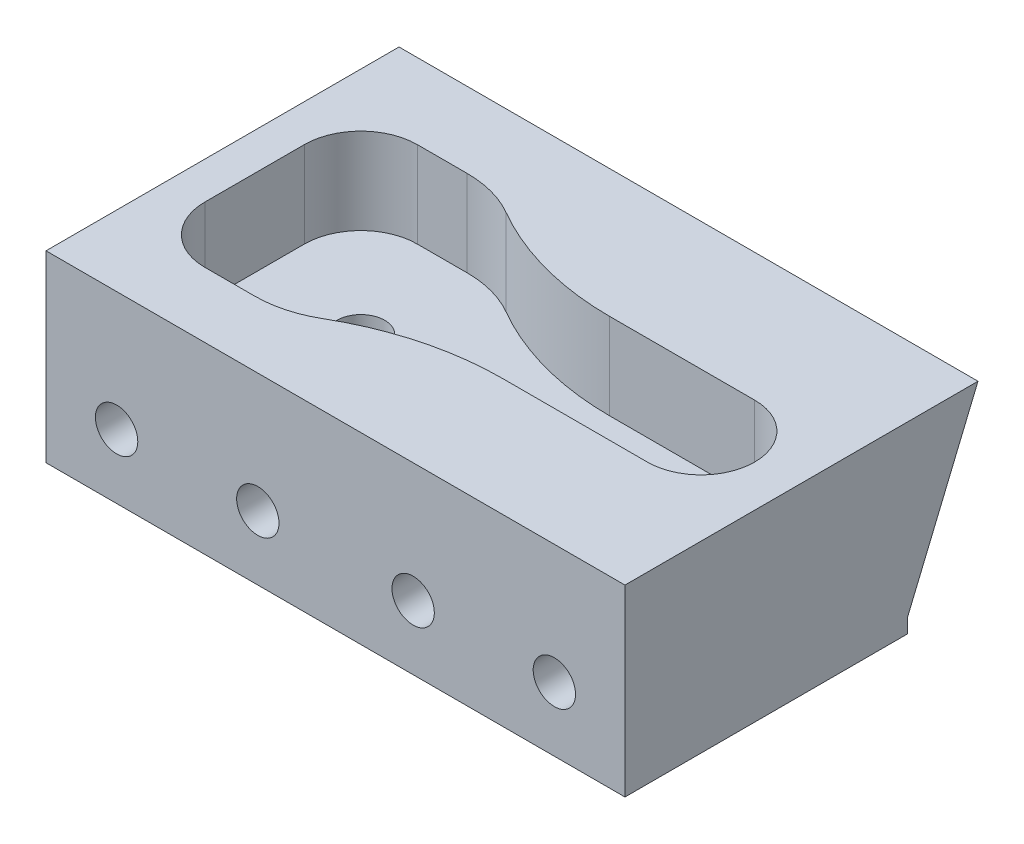
from build123d import *

# Parameters (mm, degrees)
SKETCH1_W                                           = 41
SKETCH1_H                                           = 25
BOSS_EXTRUDE1_DEPTH                                 = 13
SKETCH2_R                                           = 1.5
CUT_EXTRUDE1_DEPTH                                  = 50.749371855
LPATTERN1_COUNT                                     = 2
LPATTERN1_PITCH                                     = 10
LPATTERN3_COUNT                                     = 2
LPATTERN3_PITCH                                     = 21
SKETCH8_R                                           = 1.5
CUT_EXTRUDE5_DEPTH                                  = 8
CUT_EXTRUDE2_DEPTH                                  = 6.1
CBORE_FOR_M3_HEX_SOCKET_HEAD_CAP_SCREW1_D           = 3.4
CBORE_FOR_M3_HEX_SOCKET_HEAD_CAP_SCREW1_CBORE_D     = 6
CBORE_FOR_M3_HEX_SOCKET_HEAD_CAP_SCREW1_CBORE_DEPTH = 3.4
FILLET1_R                                           = 20
CUT_EXTRUDE4_DEPTH                                  = 50.749371855
CUT_EXTRUDE4_DEPTH_BACK                             = 50.749371855
BOSS_EXTRUDE3_START                                 = 0.2
BOSS_EXTRUDE3_DEPTH                                 = 0.2
LPATTERN2_COUNT                                     = 2
LPATTERN2_PITCH                                     = 24.09


with BuildPart() as part:
    # Sketch1 → Boss-Extrude1 (new body)
    with BuildSketch(Plane(origin=(0, 0, 0), x_dir=(1, 0, 0), z_dir=(0, 1, 0))):
        with Locations((20.5, 12.5)):
            Rectangle(SKETCH1_W, SKETCH1_H)
    extrude(amount=BOSS_EXTRUDE1_DEPTH)

    # Sketch2 → Cut-Extrude1 (cut, through all)
    with BuildSketch(Plane.XY):
        with Locations((5, 4.545)):
            Circle(SKETCH2_R)
    cut_extrude1 = extrude(amount=-CUT_EXTRUDE1_DEPTH, mode=Mode.SUBTRACT)

    # LPattern1: Cut-Extrude1 ×2
    with Locations(*[(i * LPATTERN1_PITCH, 0, 0) for i in range(1, LPATTERN1_COUNT)]):
        add(cut_extrude1, mode=Mode.SUBTRACT)

    # LPattern3: Cut-Extrude1 ×2
    with Locations(*[(i * LPATTERN3_PITCH, 0, 0) for i in range(1, LPATTERN3_COUNT)]):
        add(cut_extrude1, mode=Mode.SUBTRACT)

    # Sketch8 → Cut-Extrude5 (cut)
    with BuildSketch(Plane.XY):
        with Locations((36, 4.545)):
            Circle(SKETCH8_R)
    extrude(amount=-CUT_EXTRUDE5_DEPTH, mode=Mode.SUBTRACT)

    # Sketch3 → Cut-Extrude2 (cut)
    with BuildSketch(Plane(origin=(0, 13, 0), x_dir=(1, 0, 0), z_dir=(0, 1, 0))):
        with BuildLine():
            Line((34.25, 15.935), (16.655046189, 15.935))
            ThreePointArc((16.655046189, 15.935), (13.903703046, 18.662657505), (10.16, 19.66))
            Line((10.16, 19.66), (6.635, 19.66))
            ThreePointArc((6.635, 19.66), (3.806572875, 18.488427125), (2.635, 15.66))
            Line((2.635, 15.66), (2.635, 8.61))
            ThreePointArc((2.635, 8.61), (3.806572875, 5.781572875), (6.635, 4.61))
            Line((6.635, 4.61), (10.16, 4.61))
            ThreePointArc((10.16, 4.61), (13.903703046, 5.607342495), (16.655046189, 8.335))
            Line((16.655046189, 8.335), (34.25, 8.335))
            ThreePointArc((34.25, 8.335), (38.05, 12.135), (34.25, 15.935))
        make_face()
    extrude(amount=-CUT_EXTRUDE2_DEPTH, mode=Mode.SUBTRACT)

    # CBORE for M3 Hex Socket Head Cap Screw1 (through all)
    with Locations(Plane(origin=(0, 0, 0), x_dir=(-1, 0, 0), z_dir=(0, -1, 0))):
        with Locations((-34.25, 12.135), (-10.16, 12.135)):
            CounterBoreHole(CBORE_FOR_M3_HEX_SOCKET_HEAD_CAP_SCREW1_D / 2, CBORE_FOR_M3_HEX_SOCKET_HEAD_CAP_SCREW1_CBORE_D / 2, CBORE_FOR_M3_HEX_SOCKET_HEAD_CAP_SCREW1_CBORE_DEPTH)

    # Fillet1
    fillet1_edges = [part.edges().sort_by_distance(p)[0] for p in [
        (16.655046189, 9.95, -8.335),
        (16.655046189, 9.95, -15.935),
    ]]
    fillet(fillet1_edges, radius=FILLET1_R)

    # Sketch7 → Cut-Extrude4 (cut, two sides: drawn at the far end of the back side and taken through both)
    with BuildSketch(Plane.ZY.offset(-CUT_EXTRUDE4_DEPTH_BACK)):
        Polygon((-50.521542775, 74.251702659), (-25, 13), (-20, 1), (-20, 0), (-20, -66.356011214), (-149.691728644, -94.508034559), (-180.213271419, 46.099679315), align=None)
    extrude(amount=CUT_EXTRUDE4_DEPTH + CUT_EXTRUDE4_DEPTH_BACK, mode=Mode.SUBTRACT)

    # Sketch9 → Boss-Extrude3 (add)
    with BuildSketch(Plane.XZ.offset(-3.4).offset(BOSS_EXTRUDE3_START)):
        with BuildLine():
            ThreePointArc((11.86, -14.606841419), (13.16, -12.135), (11.86, -9.663158581))
            Line((11.86, -9.663158581), (11.86, -14.606841419))
        make_face()
        with BuildLine():
            Line((8.46, -14.606841419), (8.46, -9.663158581))
            ThreePointArc((8.46, -9.663158581), (7.16, -12.135), (8.46, -14.606841419))
        make_face()
    boss_extrude3 = extrude(amount=-BOSS_EXTRUDE3_DEPTH)

    # LPattern2: Boss-Extrude3 ×2
    with Locations(*[(i * LPATTERN2_PITCH, 0, 0) for i in range(1, LPATTERN2_COUNT)]):
        add(boss_extrude3)


solid = part.part
